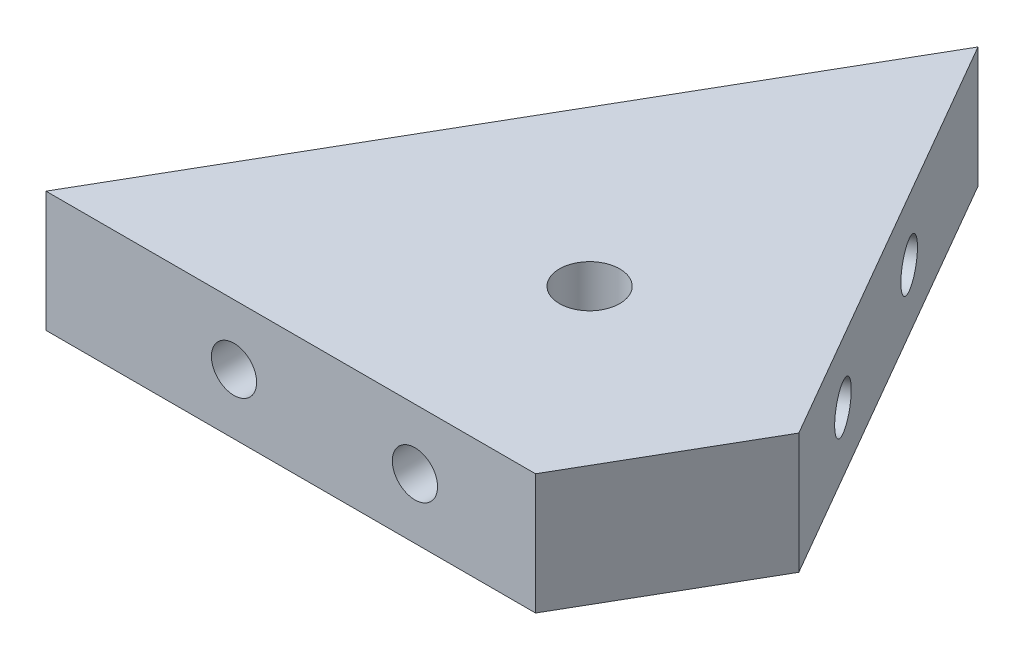
from build123d import *

# Parameters (mm, degrees)
BOSS_EXTRUDE1_DEPTH = 25.4
SKETCH2_R           = 4.7625
CUT_EXTRUDE1_DEPTH  = 12.7
SKETCH3_R           = 3.96875
CUT_EXTRUDE2_DEPTH  = 12.7
SKETCH4_R           = 3.96875
CUT_EXTRUDE3_DEPTH  = 12.7
SKETCH5_R           = 6.35
CUT_EXTRUDE4_DEPTH  = 280.690442894


with BuildPart() as part:
    # Sketch1 → Boss-Extrude1 (new body)
    with BuildSketch(Plane(origin=(0, 0, 0), x_dir=(1, 0, 0), z_dir=(0, 1, 0))):
        Polygon((119.068292428, -241.162389864), (129.21607637, -223.585912492), (51.895065274, -178.944605922), (15.973610966, -241.162389864), align=None)
    boss_extrude1 = extrude(amount=BOSS_EXTRUDE1_DEPTH)

    # Sketch2 → Cut-Extrude1 (cut)
    with BuildSketch(Plane.XY.offset(241.162389864)):
        with Locations((55.568292428, 12.7)):
            Circle(SKETCH2_R)
        with Locations((93.668292428, 12.7)):
            Circle(SKETCH2_R)
    cut_extrude1 = extrude(amount=-CUT_EXTRUDE1_DEPTH, mode=Mode.SUBTRACT)

    # Sketch3 → Cut-Extrude2 (cut)
    with BuildSketch(Plane.XY.offset(228.462389864)):
        with Locations((55.568292428, 12.7)):
            Circle(SKETCH3_R)
    cut_extrude2 = extrude(amount=-CUT_EXTRUDE2_DEPTH, mode=Mode.SUBTRACT)

    # Sketch4 → Cut-Extrude3 (cut)
    with BuildSketch(Plane.XY.offset(228.462389864)):
        with Locations((93.668292428, 12.7)):
            Circle(SKETCH4_R)
    cut_extrude3 = extrude(amount=-CUT_EXTRUDE3_DEPTH, mode=Mode.SUBTRACT)

    # Mirror1: Boss-Extrude1, Cut-Extrude1, Cut-Extrude2, Cut-Extrude3 across plane
    add(boss_extrude1.mirror(Plane(origin=(51.895065274, 25.4, 178.944605922), x_dir=(0.8660254037844389, 0, 0.4999999999999996), z_dir=(-0.49999999999999983, 0, 0.8660254037844388))))
    add(cut_extrude1.mirror(Plane(origin=(51.895065274, 25.4, 178.944605922), x_dir=(0.8660254037844389, 0, 0.4999999999999996), z_dir=(-0.49999999999999983, 0, 0.8660254037844388))), mode=Mode.SUBTRACT)
    add(cut_extrude2.mirror(Plane(origin=(51.895065274, 25.4, 178.944605922), x_dir=(0.8660254037844389, 0, 0.4999999999999996), z_dir=(-0.49999999999999983, 0, 0.8660254037844388))), mode=Mode.SUBTRACT)
    add(cut_extrude3.mirror(Plane(origin=(51.895065274, 25.4, 178.944605922), x_dir=(0.8660254037844389, 0, 0.4999999999999996), z_dir=(-0.49999999999999983, 0, 0.8660254037844388))), mode=Mode.SUBTRACT)

    # Sketch5 → Cut-Extrude4 (cut, through all)
    with BuildSketch(Plane(origin=(0, 25.4, 0), x_dir=(1, 0, 0), z_dir=(0, 1, 0))):
        with Locations((90.555570822, -201.265259207)):
            Circle(SKETCH5_R)
    extrude(amount=-CUT_EXTRUDE4_DEPTH, mode=Mode.SUBTRACT)


solid = part.part
